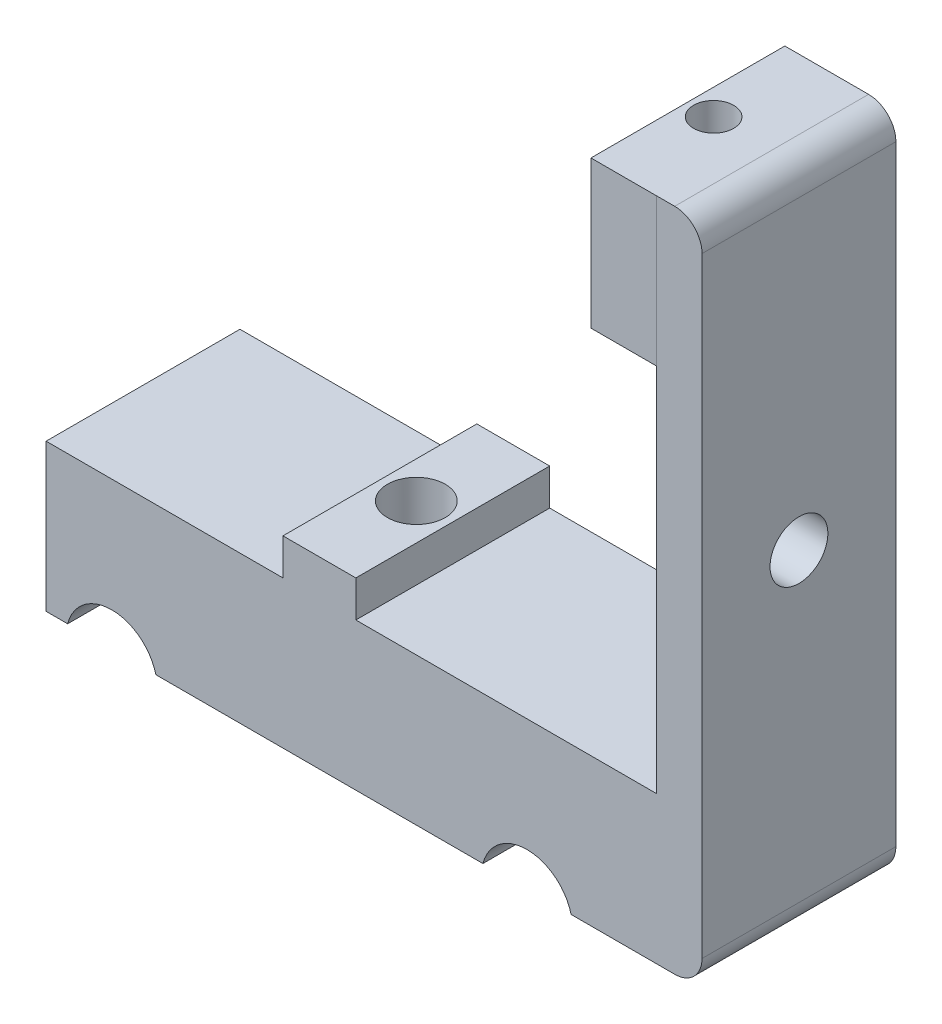
from build123d import *

# Parameters (mm, degrees)
BOSS_EXTRUDE1_DEPTH     = 10.8
BOSS_EXTRUDE2_DEPTH     = 10.64
CUT_EXTRUDE1_DEPTH      = 39.168054705
CUT_EXTRUDE1_DEPTH_BACK = 39.168054705
SKETCH5_R               = 5
FILLET1_R               = 1
SKETCH6_W               = 21.28
SKETCH6_H               = 16.18
BOSS_EXTRUDE3_DEPTH     = 12
SKETCH7_W               = 5
SKETCH7_H               = 21.281328743
BOSS_EXTRUDE4_DEPTH     = 56.83
SKETCH8_W               = 21.284331222
SKETCH8_H               = 16.18
BOSS_EXTRUDE5_DEPTH     = 7.19
FILLET3_R               = 3
SKETCH9_R               = 2.2
CUT_EXTRUDE2_DEPTH      = 85.918196519
SKETCH10_R              = 3.175
CUT_EXTRUDE3_DEPTH      = 85.918196519
SKETCH11_W              = 24.977296572
SKETCH11_H              = 9.721484234
CUT_EXTRUDE4_DEPTH      = 71.220021919
SKETCH12_R              = 3.175
CUT_EXTRUDE5_DEPTH      = 90.46728118


with BuildPart() as part:
    # Sketch2 → Boss-Extrude1 (new body)
    with BuildSketch(Plane.XY):
        Polygon((10.1, 0), (10.1, 1.709943763), (6.25480432, 7), (-6.25480432, 7), (-10.1, 1.709943763), (-10.1, 0), align=None)
    extrude(amount=BOSS_EXTRUDE1_DEPTH)

    # Sketch4 → Boss-Extrude2 (add, symmetric)
    with BuildSketch(Plane.XY):
        Polygon((-4, 0), (-4, -4.8), (-30, -4.8), (-30, -20.98), (30, -20.98), (30, -4.8), (4, -4.8), (4, 0), align=None)
    extrude(amount=BOSS_EXTRUDE2_DEPTH, both=True)

    # Sketch5 → Cut-Extrude1 (cut, two sides: drawn at the far end of the back side and taken through both)
    with BuildSketch(Plane.XY.offset(-CUT_EXTRUDE1_DEPTH_BACK)):
        with Locations((-22.790976064, -22.227391232)):
            Circle(SKETCH5_R)
        with Locations((22.790976064, -22.227391232)):
            Circle(SKETCH5_R)
    extrude(amount=CUT_EXTRUDE1_DEPTH + CUT_EXTRUDE1_DEPTH_BACK, mode=Mode.SUBTRACT)

    # Fillet1
    fillet1_edges = [part.edges().sort_by_distance(p)[0] for p in [
        (-10.1, 0, 5.4),
        (-10.1, 1.709943763, 5.4),
        (-6.25480432, 7, 5.4),
        (6.25480432, 7, 5.4),
        (10.1, 0, 5.4),
        (10.1, 1.709943763, 5.4),
    ]]
    fillet(fillet1_edges, radius=FILLET1_R)

    # Sketch6 → Boss-Extrude3 (add)
    with BuildSketch(Plane(origin=(30, 0, 0), x_dir=(0, 0, -1), z_dir=(1, 0, 0))):
        with Locations((0, -12.89)):
            Rectangle(SKETCH6_W, SKETCH6_H)
    extrude(amount=BOSS_EXTRUDE3_DEPTH)

    # Sketch7 → Boss-Extrude4 (add)
    with BuildSketch(Plane(origin=(0, -4.8, 0), x_dir=(1, 0, 0), z_dir=(0, 1, 0))):
        with Locations((39.5, 0.000664372)):
            Rectangle(SKETCH7_W, SKETCH7_H)
    extrude(amount=BOSS_EXTRUDE4_DEPTH)

    # Sketch8 → Boss-Extrude5 (add)
    with BuildSketch(Plane.ZY.offset(-37)):
        with Locations((0.000836868, 43.94)):
            Rectangle(SKETCH8_W, SKETCH8_H)
    extrude(amount=BOSS_EXTRUDE5_DEPTH)

    # Fillet3
    fillet3_edges = [part.edges().sort_by_distance(p)[0] for p in [
        (42, 52.03, -0.000664372),
        (42, -20.98, 0),
    ]]
    fillet(fillet3_edges, radius=FILLET3_R)

    # Sketch9 → Cut-Extrude2 (cut, through all)
    with BuildSketch(Plane.XZ.offset(20.98)):
        with Locations((32.632878078, 0)):
            Circle(SKETCH9_R)
    extrude(amount=-CUT_EXTRUDE2_DEPTH, mode=Mode.SUBTRACT)

    # Sketch10 → Cut-Extrude3 (cut, through all)
    with BuildSketch(Plane.XZ.offset(20.98)):
        with Locations((0.000925951, 0)):
            Circle(SKETCH10_R)
    extrude(amount=-CUT_EXTRUDE3_DEPTH, mode=Mode.SUBTRACT)

    # Sketch11 → Cut-Extrude4 (cut, through all)
    with BuildSketch(Plane.XY.offset(10.8)):
        with Locations((-0.121132817, 4.060742117)):
            Rectangle(SKETCH11_W, SKETCH11_H)
    extrude(amount=-CUT_EXTRUDE4_DEPTH, mode=Mode.SUBTRACT)

    # Sketch12 → Cut-Extrude5 (cut, through all)
    with BuildSketch(Plane(origin=(42, 0, 0), x_dir=(0, 0, -1), z_dir=(1, 0, 0))):
        with Locations((0, 15.525)):
            Circle(SKETCH12_R)
    extrude(amount=-CUT_EXTRUDE5_DEPTH, mode=Mode.SUBTRACT)


solid = part.part
